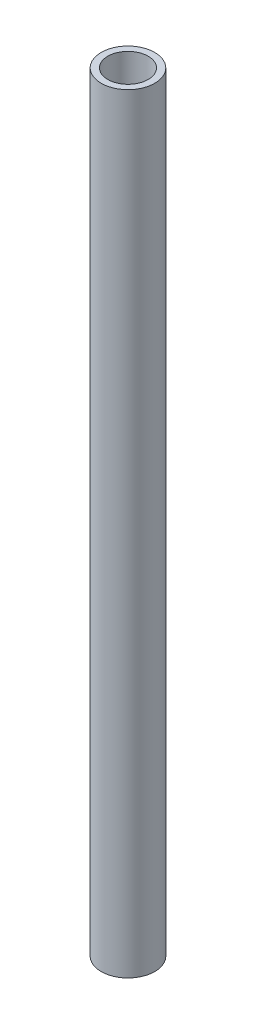
from build123d import *

# Parameters (mm, degrees)
SKETCH1_R           = 4.2037
SKETCH1_R_2         = 3.175
BOSS_EXTRUDE1_DEPTH = 120.904


with BuildPart() as part:
    # Sketch1 → Boss-Extrude1 (new body)
    with BuildSketch(Plane(origin=(0, 0, 0), x_dir=(1, 0, 0), z_dir=(0, 1, 0))):
        Circle(SKETCH1_R)
        Circle(SKETCH1_R_2, mode=Mode.SUBTRACT)
    extrude(amount=BOSS_EXTRUDE1_DEPTH)


solid = part.part
